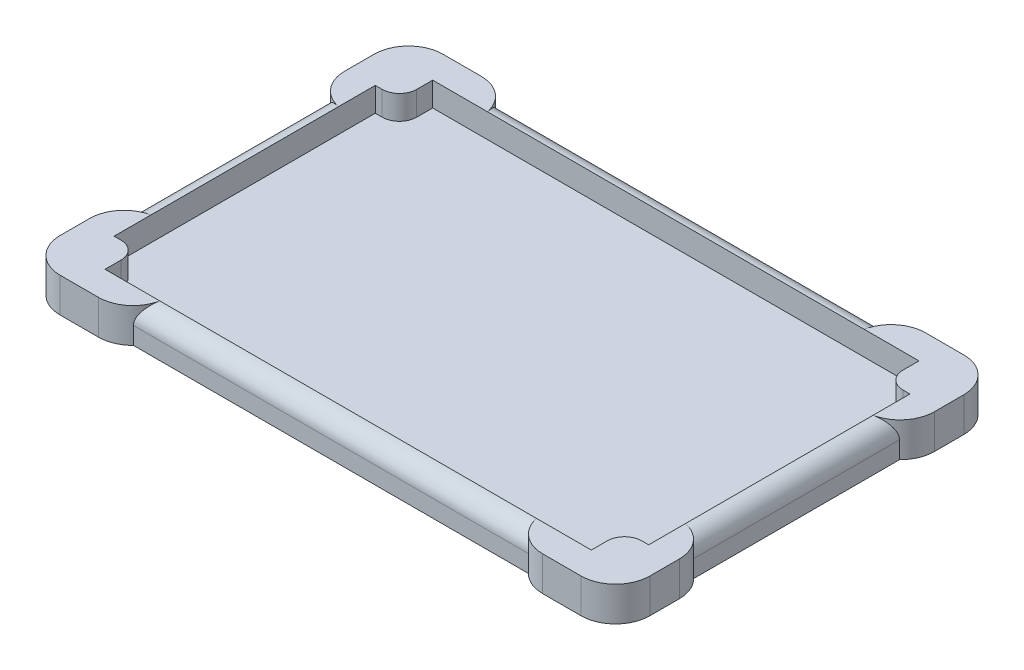
from build123d import *

# Parameters (mm, degrees)
SKETCH7_W           = 165
SKETCH7_H           = 105
SKETCH7_W_2         = 145
SKETCH7_H_2         = 85
BOSS_EXTRUDE7_DEPTH = 10
SKETCH8_W           = 28.227937213
SKETCH8_H           = 25.640206581
BOSS_EXTRUDE8_DEPTH = 10
CUT_EXTRUDE4_DEPTH  = 7
FILLET2_R           = 10
FILLET3_R           = 5
FILLET6_R           = 5


# Some blends are built 0.0001 mm under size
with BuildPart() as part:
    # Sketch7 → Boss-Extrude7 (new body)
    # profile 1 of 2: a face of its own
    with BuildSketch(Plane(origin=(0, 0, 0), x_dir=(1, 0, 0), z_dir=(0, 1, 0))):
        with Locations((72.5, 42.5)):
            Rectangle(SKETCH7_W, SKETCH7_H)
        with Locations((72.5, 42.5)):
            Rectangle(SKETCH7_W_2, SKETCH7_H_2, mode=Mode.SUBTRACT)
    # profile 2 of 2: a face of its own
    with BuildSketch(Plane(origin=(0, 0, 0), x_dir=(1, 0, 0), z_dir=(0, 1, 0))):
        with Locations((72.5, 42.5)):
            Rectangle(SKETCH7_W_2, SKETCH7_H_2)
    extrude(amount=BOSS_EXTRUDE7_DEPTH)

    # Sketch8 → Boss-Extrude8 (add)
    with BuildSketch(Plane(origin=(0, 10, 0), x_dir=(1, 0, 0), z_dir=(0, 1, 0))):
        with Locations((1.113968607, -0.179896709)):
            Rectangle(SKETCH8_W, SKETCH8_H)
        with Locations((143.886031393, -0.179896709)):
            Rectangle(SKETCH8_W, SKETCH8_H)
        with Locations((143.886031393, 85.179896709)):
            Rectangle(SKETCH8_W, SKETCH8_H)
        with Locations((1.113968607, 85.179896709)):
            Rectangle(SKETCH8_W, SKETCH8_H)
    extrude(amount=-BOSS_EXTRUDE8_DEPTH)

    # Sketch10 → Cut-Extrude4 (cut)
    with BuildSketch(Plane(origin=(0, 10, 0), x_dir=(1, 0, 0), z_dir=(0, 1, 0))):
        Polygon((2, -5), (143, -5), (143, 4.63003775), (150, 4.63003775), (150, 80.36996225), (143, 80.36996225), (143, 90), (2, 90), (2, 80.36996225), (-5, 80.36996225), (-5, 4.63003775), (2, 4.63003775), align=None)
    extrude(amount=-CUT_EXTRUDE4_DEPTH, mode=Mode.SUBTRACT)

    # Fillet2
    # the kernel refuses this fillet: 10 mm, written as the material it takes off along each edge
    with BuildSketch(Plane(origin=(-13, 27.853571071, -72.359793419), x_dir=(1, 0, 0), z_dir=(0, -1, 0)), Plane(origin=(129.772062787, 27.853571071, -98), x_dir=(0, 0, 1), z_dir=(0, -1, 0)), Plane(origin=(158, 27.853571071, -12.640206581), x_dir=(-1, 0, 0), z_dir=(0, -1, 0)), Plane(origin=(15.227937213, 27.853571071, 13), x_dir=(0, 0, -1), z_dir=(0, -1, 0))) as fillet2_piece_1:
        with BuildLine():
            CenterArc((10, -7.141428429), FILLET2_R, 134.427004001, 45.572995999)
            Line((0, -7.141428429), (-0.2, -7.141428429))
            Line((-0.2, -7.141428429), (-0.2, 0))
            Line((-0.2, 0), (0, 0.2))
            ThreePointArc((0, 0.2), (1.5, 0.2), (2.86, 0.142828569))
            Line((2.86, 0.142828569), (3, 0))
        make_face()
    extrude(amount=45.707142143, mode=Mode.SUBTRACT)
    with BuildSketch(Plane(origin=(15.227937213, 27.853571071, -98), x_dir=(-1, 0, 0), z_dir=(0, -1, 0)), Plane(origin=(-13, 27.853571071, -12.640206581), x_dir=(0, 0, 1), z_dir=(0, -1, 0)), Plane(origin=(158, 27.853571071, -72.359793419), x_dir=(0, 0, -1), z_dir=(0, -1, 0)), Plane(origin=(129.772062787, 27.853571071, 13), x_dir=(1, 0, 0), z_dir=(0, -1, 0))) as fillet2_piece_2:
        with BuildLine():
            CenterArc((7.141428429, -10), FILLET2_R, 90, 45.572995999)
            Line((0, -3), (-0.142828569, -2.86))
            ThreePointArc((-0.142828569, -2.86), (-0.2, -1.5), (-0.2, 0))
            Line((-0.2, 0), (0, 0.2))
            Line((0, 0.2), (7.141428429, 0.2))
            Line((7.141428429, 0.2), (7.141428429, 0))
        make_face()
    extrude(amount=45.707142143, mode=Mode.SUBTRACT)
    with BuildSketch(Plane(origin=(-13, 35, -98), x_dir=(0, 0, 1), z_dir=(0, -1, 0)), Plane(origin=(158, 35, -98), x_dir=(-1, 0, 0), z_dir=(0, -1, 0)), Plane(origin=(158, 35, 13), x_dir=(0, 0, -1), z_dir=(0, -1, 0))) as fillet2_piece_3:
        with BuildLine():
            CenterArc((FILLET2_R, -FILLET2_R), FILLET2_R, 90, 90)
            Line((0, -FILLET2_R), (-FILLET2_R * 0.02, -FILLET2_R))
            Line((-FILLET2_R * 0.02, -FILLET2_R), (-FILLET2_R * 0.02, FILLET2_R * 0.02))
            Line((-FILLET2_R * 0.02, FILLET2_R * 0.02), (FILLET2_R, FILLET2_R * 0.02))
            Line((FILLET2_R, FILLET2_R * 0.02), (FILLET2_R, 0))
        make_face()
    extrude(amount=60, mode=Mode.SUBTRACT)
    with BuildSketch(Plane(origin=(-13, 35, 13), x_dir=(0, 0, -1), z_dir=(0, -1, 0))) as fillet2_piece_4:
        with BuildLine():
            CenterArc((FILLET2_R, FILLET2_R), FILLET2_R, 180, 90)
            Line((0, FILLET2_R), (-FILLET2_R * 0.02, FILLET2_R))
            Line((-FILLET2_R * 0.02, FILLET2_R), (-FILLET2_R * 0.02, -FILLET2_R * 0.02))
            Line((-FILLET2_R * 0.02, -FILLET2_R * 0.02), (FILLET2_R, -FILLET2_R * 0.02))
            Line((FILLET2_R, -FILLET2_R * 0.02), (FILLET2_R, 0))
        make_face()
    extrude(amount=60, mode=Mode.SUBTRACT)

    # Fillet3
    fillet3_edges = [part.edges().sort_by_distance(p)[0] for p in [
        (143, 6.5, -80.36996225),
        (143, 6.5, -4.63003775),
        (2, 6.5, -4.63003775),
        (2, 6.5, -80.36996225),
    ]]
    fillet(fillet3_edges, radius=FILLET3_R)

    # Fillet6
    fillet6_edges = [part.edges().sort_by_distance(p)[0] for p in [
        (72.5, 10, -95),
        (155, 10, -42.5),
        (72.5, 10, 10),
        (-10, 10, -42.5),
    ]]
    fillet(fillet6_edges, radius=FILLET6_R - 0.0001)  # a hair under: the kernel refuses the full size


solid = part.part
